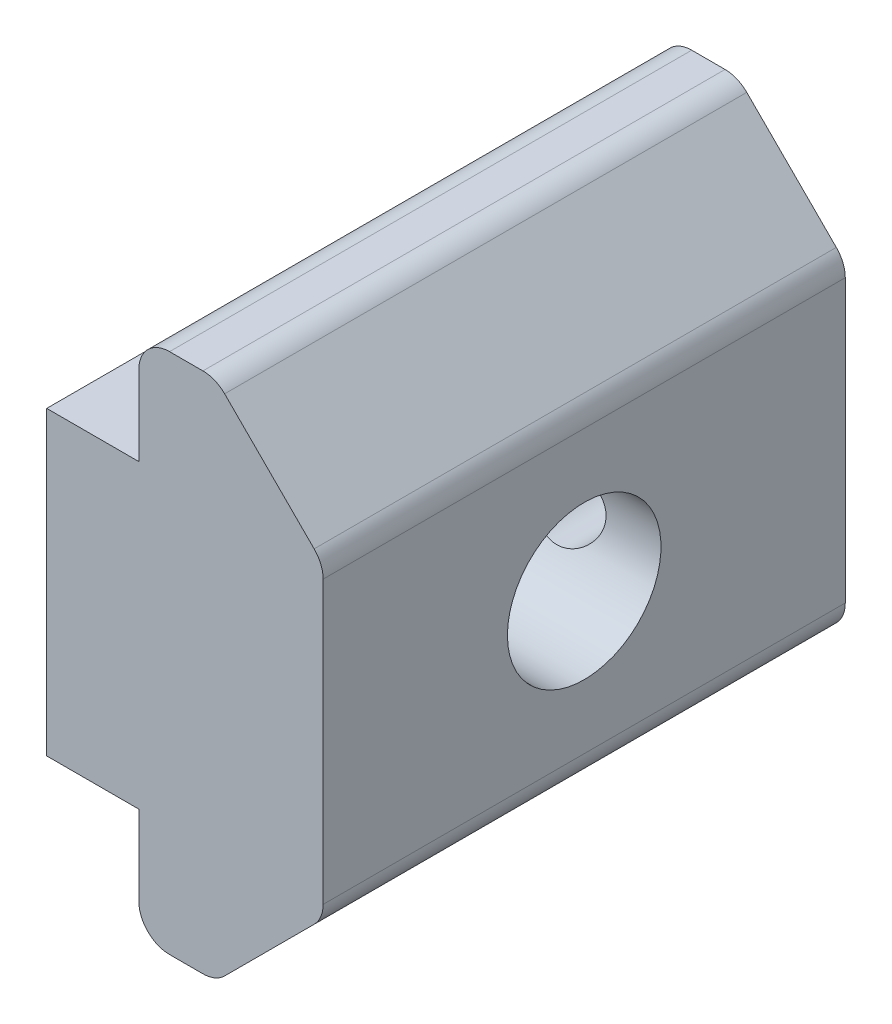
from build123d import *

# Parameters (mm, degrees)
BOSS_EXTRUDE2_DEPTH       = 8.5
BOSS_EXTRUDE2_DEPTH_BACK  = 8.5
M6_TAPPED_HOLE1_D         = 5
M3X0_5_TAPPED_HOLE1_D     = 2.5
M3X0_5_TAPPED_HOLE1_DEPTH = 7.5
M3X0_5_TAPPED_HOLE1_TIP   = 0.751075774


with BuildPart() as part:
    # Model → Boss-Extrude2 (new, two sides: drawn at the far end of the back side and taken through both)
    with BuildSketch(Plane.XY.offset(-BOSS_EXTRUDE2_DEPTH_BACK)):
        with BuildLine():
            Line((64.292892272, 21.792891862), (67.207107272, 24.707105862))
            ThreePointArc((67.207107272, 24.707105862), (67.423880138, 25.031529799), (67.500000272, 25.414213862))
            Line((67.500000272, 25.414213862), (67.500000272, 34.5857853))
            ThreePointArc((67.500000272, 34.5857853), (67.423879863, 34.968468589), (67.207107272, 35.292891862))
            Line((67.207107272, 35.292891862), (64.292892272, 38.207106862))
            ThreePointArc((64.292892272, 38.207106862), (63.96846972, 38.423879155), (63.585787272, 38.499999862))
            Line((63.585787272, 38.499999862), (62.500000272, 38.499999862))
            ThreePointArc((62.500000272, 38.499999862), (61.79289349, 38.207106644), (61.500000272, 37.499999862))
            Line((61.500000272, 37.499999862), (61.500000272, 34.899999862))
            Line((61.500000272, 34.899999862), (58.500000272, 34.899999862))
            Line((58.500000272, 34.899999862), (58.500000272, 25.099999862))
            Line((58.500000272, 25.099999862), (61.500000272, 25.099999862))
            Line((61.500000272, 25.099999862), (61.500000272, 22.499999862))
            ThreePointArc((61.500000272, 22.499999862), (61.79289349, 21.792893081), (62.500000272, 21.499999862))
            Line((62.500000272, 21.499999862), (63.585787272, 21.499999862))
            ThreePointArc((63.585787272, 21.499999862), (63.968469605, 21.576120108), (64.292892272, 21.792891862))
        make_face()
    extrude(amount=BOSS_EXTRUDE2_DEPTH + BOSS_EXTRUDE2_DEPTH_BACK)

    # M6 Tapped Hole1 (through all)
    with Locations(Plane.ZY.offset(-58.500000272)):
        with Locations((0, 29.999999862)):
            Hole(M6_TAPPED_HOLE1_D / 2)

    # M3x0.5 Tapped Hole1
    with Locations(Plane(origin=(0, 0, -8.5), x_dir=(-1, 0, 0), z_dir=(0, 0, -1))):
        with Locations((-64.461940205, 29.965764831)):
            Hole(M3X0_5_TAPPED_HOLE1_D / 2, depth=M3X0_5_TAPPED_HOLE1_DEPTH)
            with Locations((0, 0, -(M3X0_5_TAPPED_HOLE1_DEPTH + M3X0_5_TAPPED_HOLE1_TIP / 2))):  # 118° drill point
                Cone(0, M3X0_5_TAPPED_HOLE1_D / 2, M3X0_5_TAPPED_HOLE1_TIP, mode=Mode.SUBTRACT)


solid = part.part
